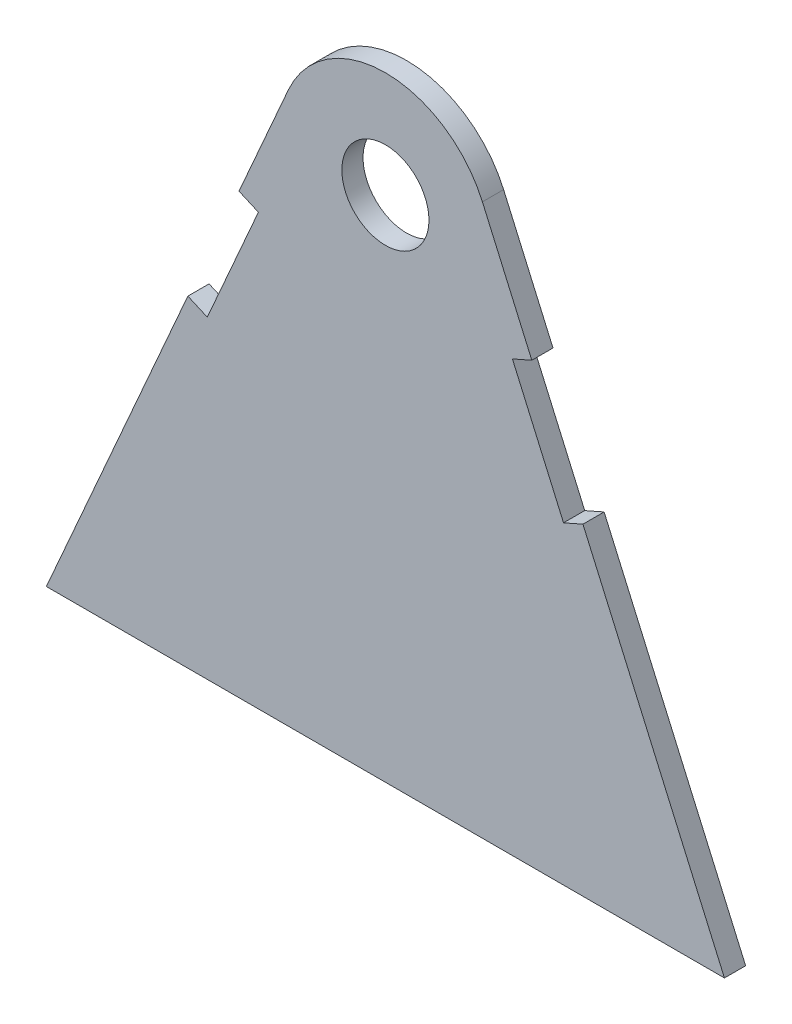
from build123d import *

# Parameters (mm, degrees)
BOSS_EXTRUDE1_DEPTH     = 1.5875
F_1_4_CLEARANCE_HOLE1_D = 6.5278


with BuildPart() as part:
    # Sketch1 → Boss-Extrude1 (new body)
    with BuildSketch(Plane.XY):
        with BuildLine():
            ThreePointArc((7.267638826, 3.191446717), (0, 7.9375), (-7.267638826, 3.191446717))
            Line((-7.267638826, 3.191446717), (-10.968425472, -5.236073182))
            Line((-10.968425472, -5.236073182), (-9.514897707, -5.874362525))
            Line((-9.514897707, -5.874362525), (-13.344633767, -14.595529116))
            Line((-13.344633767, -14.595529116), (-14.798161533, -13.957239773))
            Line((-14.798161533, -13.957239773), (-25.4, -38.1))
            Line((-25.4, -38.1), (25.4, -38.1))
            Line((25.4, -38.1), (14.798161533, -13.957239773))
            Line((14.798161533, -13.957239773), (13.344633767, -14.595529116))
            Line((13.344633767, -14.595529116), (9.514897707, -5.874362525))
            Line((9.514897707, -5.874362525), (10.968425472, -5.236073182))
            Line((10.968425472, -5.236073182), (7.267638826, 3.191446717))
        make_face()
    extrude(amount=BOSS_EXTRUDE1_DEPTH)

    # 1/4 Clearance Hole1 (through all)
    with Locations(Plane.XY.offset(1.5875)):
        with Locations((0, 0)):
            Hole(F_1_4_CLEARANCE_HOLE1_D / 2)


solid = part.part
